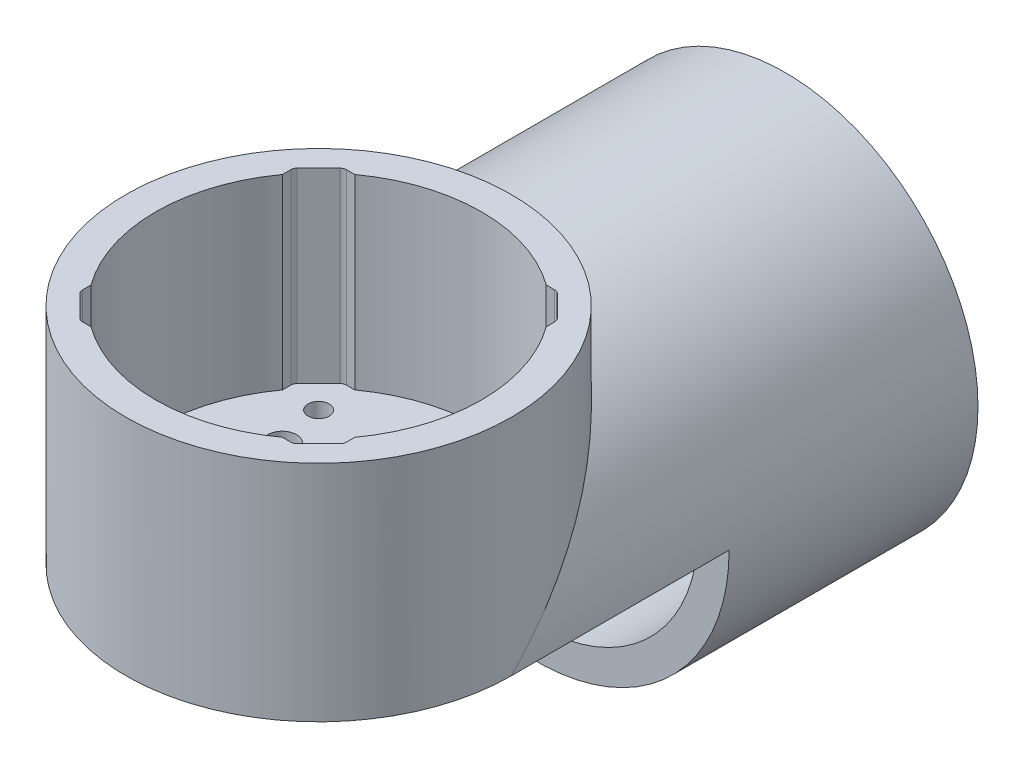
from build123d import *
from OCP.BRepAlgoAPI import BRepAlgoAPI_Cut
from OCP.TopTools import TopTools_ListOfShape
from build123d.topology import SkipClean

# Parameters (mm, degrees)
SKETCH3_R                = 31
SKETCH3_R_2              = 26
BOSS_EXTRUDE1_DEPTH      = 7.0104
SKETCH4_R                = 31
SKETCH4_R_2              = 26
BOSS_EXTRUDE2_DEPTH      = 10
SKETCH5_R                = 1.5
BOSS_EXTRUDE3_DEPTH      = 10
SKETCH7_R                = 31
SKETCH7_R_2              = 26
BOSS_EXTRUDE4_DEPTH      = 13
SKETCH9_R                = 31
SKETCH9_R_2              = 26.2
BOSS_EXTRUDE5_DEPTH      = 36
BOSS_EXTRUDE9_REACH      = 91.627
SKETCH35_R               = 26.2
BOSS_EXTRUDE10_DEPTH     = 6
SKETCH37_R               = 2.3
CUT_EXTRUDE1_DEPTH       = 6
SKETCH39_R               = 11.1
CUT_EXTRUDE2_DEPTH       = 2.1
SKETCH41_R               = 5
CUT_EXTRUDE3_DEPTH       = 4
SKETCH47_R               = 1.7
CUT_EXTRUDE7_DEPTH       = 115.339827959
CIRPATTERN1_START        = -1
CIRPATTERN1_OUTLINE_R    = 3.000000205
CIRPATTERN1_OUTLINE_R_2  = 1.7
CIRPATTERN1_DEPTH        = 2.5849999
BOSS_EXTRUDE11_DEPTH     = 10
CUT_EXTRUDE10_DEPTH      = 4.4
CUT_EXTRUDE10_DEPTH_BACK = 1
SKETCH48_W               = 5
SKETCH48_H               = 56
CUT_EXTRUDE12_DEPTH      = 128.254061851
CUT_EXTRUDE12_DEPTH_BACK = 30
SKETCH57_R               = 26
CUT_EXTRUDE15_DEPTH      = 8


with BuildPart() as part:
    # Sketch3 → Boss-Extrude1 (new body)
    with BuildSketch(Plane.XY.offset(-2.359079422)):
        with Locations(Location((0, 0, 0), (0, 0, 270))):
            Circle(SKETCH3_R)
        with Locations(Location((0, 0, 0), (0, 0, 270))):
            Circle(SKETCH3_R_2, mode=Mode.SUBTRACT)
    extrude(amount=BOSS_EXTRUDE1_DEPTH)

    # Sketch4 → Boss-Extrude2 (add)
    with BuildSketch(Plane.XY.offset(4.651320578)):
        Circle(SKETCH4_R)
        Circle(SKETCH4_R_2, mode=Mode.SUBTRACT)
    extrude(amount=BOSS_EXTRUDE2_DEPTH)

    # Sketch5 → Boss-Extrude3 (add)
    with BuildSketch(Plane.XY.offset(4.651320578)):
        with Locations((26, 0)):
            Circle(SKETCH5_R)
        with Locations((25.299166635, -5.996012639)):
            Circle(SKETCH5_R)
        with Locations((23.234448648, -11.668778685)):
            Circle(SKETCH5_R)
        with Locations((19.917155521, -16.712477852)):
            Circle(SKETCH5_R)
        with Locations((15.526123384, -20.855203012)):
            Circle(SKETCH5_R)
        with Locations((10.298073917, -23.873618779)):
            Circle(SKETCH5_R)
        with Locations((4.514852619, -25.605001578)):
            Circle(SKETCH5_R)
        with Locations((-1.511765552, -25.956012115)):
            Circle(SKETCH5_R)
        with Locations((-7.45688405, -24.90772732)):
            Circle(SKETCH5_R)
        with Locations((-13, -22.516660498)):
            Circle(SKETCH5_R)
        with Locations((-17.842282585, -18.911714681)):
            Circle(SKETCH5_R)
        with Locations((-21.722683097, -14.28723343)):
            Circle(SKETCH5_R)
        with Locations((-24.43200814, -8.892523726)):
            Circle(SKETCH5_R)
        with Locations((-25.824197301, -3.018415767)):
            Circle(SKETCH5_R)
        with Locations((-25.824197301, 3.018415767)):
            Circle(SKETCH5_R)
        with Locations((-24.43200814, 8.892523726)):
            Circle(SKETCH5_R)
        with Locations((-21.722683097, 14.28723343)):
            Circle(SKETCH5_R)
        with Locations((-17.842282585, 18.911714681)):
            Circle(SKETCH5_R)
        with Locations((-13, 22.516660498)):
            Circle(SKETCH5_R)
        with Locations((-7.45688405, 24.90772732)):
            Circle(SKETCH5_R)
        with Locations((-1.511765552, 25.956012115)):
            Circle(SKETCH5_R)
        with Locations((4.514852619, 25.605001578)):
            Circle(SKETCH5_R)
        with Locations((10.298073917, 23.873618779)):
            Circle(SKETCH5_R)
        with Locations((15.526123384, 20.855203012)):
            Circle(SKETCH5_R)
        with Locations((19.917155521, 16.712477852)):
            Circle(SKETCH5_R)
        with Locations((23.234448648, 11.668778685)):
            Circle(SKETCH5_R)
        with Locations((25.299166635, 5.996012639)):
            Circle(SKETCH5_R)
    extrude(amount=BOSS_EXTRUDE3_DEPTH)

    # Sketch7 → Boss-Extrude4 (add)
    with BuildSketch(Plane.XY.offset(14.651320578)):
        Circle(SKETCH7_R)
        Circle(SKETCH7_R_2, mode=Mode.SUBTRACT)
    extrude(amount=BOSS_EXTRUDE4_DEPTH)


with BuildPart() as body_2:
    # Sketch9 → Boss-Extrude5 (new body)
    with BuildSketch(Plane(origin=(0, 0, 0), x_dir=(1, 0, 0), z_dir=(0, 1, 0))):
        with Locations(Location((0, -72.651320578, 0), (0, 0, 270))):
            Circle(SKETCH9_R)
        with Locations(Location((0, -72.651320578, 0), (0, 0, 270))):
            Circle(SKETCH9_R_2, mode=Mode.SUBTRACT)
    extrude(amount=BOSS_EXTRUDE5_DEPTH)

    # Sketch34 → Boss-Extrude9 (add, up to next)
    with BuildSketch(Plane.XY.offset(27.651320578), mode=Mode.PRIVATE) as boss_extrude9_sk1:
        with BuildLine():
            Line((-31, 0), (-26, 0))
            ThreePointArc((-26, 0), (0, 26), (26, 0))
            Line((26, 0), (31, 0))
            ThreePointArc((31, 0), (0, 31), (-31, 0))
        make_face()
    boss_extrude9_tool1 = extrude(boss_extrude9_sk1.sketch, amount=BOSS_EXTRUDE9_REACH, mode=Mode.PRIVATE) - body_2.part

    add(part.part)  # Boss-Extrude9 merges part
    add(boss_extrude9_tool1.solids().sort_by_distance((28.5, 0.693181, 27.651321))[0])

    # Sketch35 → Boss-Extrude10 (add)
    with BuildSketch(Plane.XZ):
        with Locations(Location((0, 72.651320578, 0), (0, 0, 270))):
            Circle(SKETCH35_R)
    extrude(amount=-BOSS_EXTRUDE10_DEPTH)

    # Sketch37 → Cut-Extrude1 (cut)
    with BuildSketch(Plane(origin=(0, 6, 0), x_dir=(1, 0, 0), z_dir=(0, 1, 0))):
        with Locations(Location((0, -88.651320578, 0), (0, 0, 270))):
            Circle(SKETCH37_R)
        with Locations(Location((-13.856406461, -80.651320578, 0), (0, 0, 270))):
            Circle(SKETCH37_R)
        with Locations(Location((-13.856406461, -64.651320578, 0), (0, 0, 270))):
            Circle(SKETCH37_R)
        with Locations(Location((0, -56.651320578, 0), (0, 0, 270))):
            Circle(SKETCH37_R)
        with Locations(Location((13.856406461, -64.651320578, 0), (0, 0, 270))):
            Circle(SKETCH37_R)
        with Locations(Location((13.856406461, -80.651320578, 0), (0, 0, 270))):
            Circle(SKETCH37_R)
    extrude(amount=-CUT_EXTRUDE1_DEPTH, mode=Mode.SUBTRACT)

    # Sketch39 → Cut-Extrude2 (cut)
    with BuildSketch(Plane(origin=(0, 6, 0), x_dir=(1, 0, 0), z_dir=(0, 1, 0))):
        with Locations(Location((0, -72.651320578, 0), (0, 0, 270))):
            Circle(SKETCH39_R)
    extrude(amount=-CUT_EXTRUDE2_DEPTH, mode=Mode.SUBTRACT)

    # Sketch41 → Cut-Extrude3 (cut)
    with BuildSketch(Plane(origin=(0, 3.9, 0), x_dir=(1, 0, 0), z_dir=(0, 1, 0))):
        with Locations(Location((0, -72.651320578, 0), (0, 0, 270))):
            Circle(SKETCH41_R)
    extrude(amount=-CUT_EXTRUDE3_DEPTH, mode=Mode.SUBTRACT)

    # Sketch47 → Cut-Extrude7 (cut, through all)
    with BuildSketch(Plane(origin=(0, 6, 0), x_dir=(1, 0, 0), z_dir=(0, 1, 0))):
        with Locations(Location((-15.5, -88.15132, 0), (0, 0, 270))):
            Circle(SKETCH47_R)
        with Locations(Location((-15.499999422, -57.151320578, 0), (0, 0, 270))):
            Circle(SKETCH47_R)
        with Locations(Location((15.5, -57.151321156, 0), (0, 0, 270))):
            Circle(SKETCH47_R)
        with Locations(Location((15.499999422, -88.151320578, 0), (0, 0, 270))):
            Circle(SKETCH47_R)
    extrude(amount=-CUT_EXTRUDE7_DEPTH, mode=Mode.SUBTRACT)


with BuildPart() as cut_revolve1_tool:
    # Sketch43 → Cut-Revolve1 (revolve)
    with BuildSketch(Plane(origin=(-8.335079333, 0, 88.151320134), x_dir=(0.9999999999999999, 0, 1.8652727112514236e-08), z_dir=(-1.8652727112514233e-08, 0, 0.9999999999999998))):
        Polygon((20.835078549, 0), (22.135079128, 0), (22.135079128, 2.885), (20.835078549, 1.585), align=None)
    revolve(axis=Axis((15.499999422, 0, 88.151320578), (0, 1, 0)))


with BuildPart() as body_2_1:
    add(body_2.part)

    # Cut-Revolve1: cut by cut_revolve1_tool, with a tolerance
    cut_revolve1_stock = TopTools_ListOfShape()
    cut_revolve1_stock.Append(body_2_1.part.wrapped)
    cut_revolve1_tools = TopTools_ListOfShape()
    cut_revolve1_tools.Append(cut_revolve1_tool.part.wrapped)
    cut_revolve1_cut = BRepAlgoAPI_Cut()
    cut_revolve1_cut.SetArguments(cut_revolve1_stock)
    cut_revolve1_cut.SetTools(cut_revolve1_tools)
    cut_revolve1_cut.SetFuzzyValue(0.00001)
    cut_revolve1_cut.Build()
    add(Compound.cast(cut_revolve1_cut.Shape()).solids(), mode=Mode.REPLACE)


with BuildPart() as cirpattern1_tool:
    # CirPattern1: read off the stored shape, not the designer's step
    # CirPattern1 outline → CirPattern1 (new body)
    # profile 1 of 3: a face of its own
    with BuildSketch(Plane(origin=(0, 0, 0), x_dir=(1, 0, 0), z_dir=(0, 1, 0)).offset(CIRPATTERN1_START)):
        with Locations((15.5, -57.151321156)):
            Circle(CIRPATTERN1_OUTLINE_R)
        with Locations((15.5, -57.151321156)):
            Circle(CIRPATTERN1_OUTLINE_R_2, mode=Mode.SUBTRACT)
    # profile 2 of 3: a face of its own
    with BuildSketch(Plane(origin=(0, 0, 0), x_dir=(1, 0, 0), z_dir=(0, 1, 0)).offset(CIRPATTERN1_START)):
        with Locations((-15.499999422, -57.151320578)):
            Circle(CIRPATTERN1_OUTLINE_R)
        with Locations((-15.499999422, -57.151320578)):
            Circle(CIRPATTERN1_OUTLINE_R_2, mode=Mode.SUBTRACT)
    # profile 3 of 3: a face of its own
    with BuildSketch(Plane(origin=(0, 0, 0), x_dir=(1, 0, 0), z_dir=(0, 1, 0)).offset(CIRPATTERN1_START)):
        with Locations((-15.5, -88.15132)):
            Circle(CIRPATTERN1_OUTLINE_R)
        with Locations((-15.5, -88.15132)):
            Circle(CIRPATTERN1_OUTLINE_R_2, mode=Mode.SUBTRACT)
    extrude(amount=CIRPATTERN1_DEPTH)


with BuildPart() as body_2_2:
    add(body_2_1.part)

    # CirPattern1: cut by cirpattern1_tool, with a tolerance
    cirpattern1_stock = TopTools_ListOfShape()
    cirpattern1_stock.Append(body_2_2.part.wrapped)
    cirpattern1_tools = TopTools_ListOfShape()
    cirpattern1_tools.Append(cirpattern1_tool.part.wrapped)
    cirpattern1_cut = BRepAlgoAPI_Cut()
    cirpattern1_cut.SetArguments(cirpattern1_stock)
    cirpattern1_cut.SetTools(cirpattern1_tools)
    cirpattern1_cut.SetFuzzyValue(0.00001)
    cirpattern1_cut.Build()
    add(Compound.cast(cirpattern1_cut.Shape()).solids(), mode=Mode.REPLACE)


with BuildPart() as cirpattern1_2_tool:
    # CirPattern1 2: loft between two sections, ruled curve by curve
    cirpattern1_2_from = [
        Edge.make_three_point_arc((15.5, 2.885, 55.45132153), (17.199999627, 2.885, 57.151321156), (15.5, 2.885, 58.851320783)),
        Edge.make_three_point_arc((15.5, 2.885, 58.851320783), (13.800000373, 2.885, 57.151321156), (15.5, 2.885, 55.45132153)),
    ]
    cirpattern1_2_to = [
        Edge.make_three_point_arc((15.5, 1.585, 54.151320951), (18.500000205, 1.585, 57.151321156), (15.5, 1.585, 60.151321362)),
        Edge.make_three_point_arc((15.5, 1.585, 60.151321362), (12.499999795, 1.585, 57.151321156), (15.5, 1.585, 54.151320951)),
    ]
    cirpattern1_2 = Solid(Shell([*[Face.make_surface_from_curves(cirpattern1_2_from[k], cirpattern1_2_to[k]) for k in range(2)], Face(Wire(cirpattern1_2_from)), Face(Wire(cirpattern1_2_to))]))
    add(cirpattern1_2)


with BuildPart() as body_2_3:
    add(body_2_2.part)

    # CirPattern1 2: cut by cirpattern1_2_tool, with a tolerance
    cirpattern1_2_stock = TopTools_ListOfShape()
    cirpattern1_2_stock.Append(body_2_3.part.wrapped)
    cirpattern1_2_tools = TopTools_ListOfShape()
    cirpattern1_2_tools.Append(cirpattern1_2_tool.part.wrapped)
    cirpattern1_2_cut = BRepAlgoAPI_Cut()
    cirpattern1_2_cut.SetArguments(cirpattern1_2_stock)
    cirpattern1_2_cut.SetTools(cirpattern1_2_tools)
    cirpattern1_2_cut.SetFuzzyValue(0.00001)
    cirpattern1_2_cut.Build()
    add(Compound.cast(cirpattern1_2_cut.Shape()).solids(), mode=Mode.REPLACE)


with BuildPart() as cirpattern1_3_tool:
    # CirPattern1 3: loft between two sections, ruled curve by curve
    cirpattern1_3_from = [
        Edge.make_three_point_arc((-17.199999049, 2.885, 57.151320578), (-15.499999422, 2.885, 55.451320951), (-13.799999795, 2.885, 57.151320578)),
        Edge.make_three_point_arc((-13.799999795, 2.885, 57.151320578), (-15.499999422, 2.885, 58.851320205), (-17.199999049, 2.885, 57.151320578)),
    ]
    cirpattern1_3_to = [
        Edge.make_three_point_arc((-18.499999627, 1.585, 57.151320578), (-15.499999422, 1.585, 54.151320373), (-12.499999217, 1.585, 57.151320578)),
        Edge.make_three_point_arc((-12.499999217, 1.585, 57.151320578), (-15.499999422, 1.585, 60.151320783), (-18.499999627, 1.585, 57.151320578)),
    ]
    cirpattern1_3 = Solid(Shell([*[Face.make_surface_from_curves(cirpattern1_3_from[k], cirpattern1_3_to[k]) for k in range(2)], Face(Wire(cirpattern1_3_from)), Face(Wire(cirpattern1_3_to))]))
    add(cirpattern1_3)


with BuildPart() as body_2_4:
    add(body_2_3.part)

    # CirPattern1 3: cut by cirpattern1_3_tool, with a tolerance
    cirpattern1_3_stock = TopTools_ListOfShape()
    cirpattern1_3_stock.Append(body_2_4.part.wrapped)
    cirpattern1_3_tools = TopTools_ListOfShape()
    cirpattern1_3_tools.Append(cirpattern1_3_tool.part.wrapped)
    cirpattern1_3_cut = BRepAlgoAPI_Cut()
    cirpattern1_3_cut.SetArguments(cirpattern1_3_stock)
    cirpattern1_3_cut.SetTools(cirpattern1_3_tools)
    cirpattern1_3_cut.SetFuzzyValue(0.00001)
    cirpattern1_3_cut.Build()
    add(Compound.cast(cirpattern1_3_cut.Shape()).solids(), mode=Mode.REPLACE)


with BuildPart() as cirpattern1_4_tool:
    # CirPattern1 4: loft between two sections, ruled curve by curve
    cirpattern1_4_from = [
        Edge.make_three_point_arc((-15.5, 2.885, 89.851319627), (-17.199999627, 2.885, 88.15132), (-15.5, 2.885, 86.451320373)),
        Edge.make_three_point_arc((-15.5, 2.885, 86.451320373), (-13.800000373, 2.885, 88.15132), (-15.5, 2.885, 89.851319627)),
    ]
    cirpattern1_4_to = [
        Edge.make_three_point_arc((-15.5, 1.585, 91.151320205), (-18.500000205, 1.585, 88.15132), (-15.5, 1.585, 85.151319795)),
        Edge.make_three_point_arc((-15.5, 1.585, 85.151319795), (-12.499999795, 1.585, 88.15132), (-15.5, 1.585, 91.151320205)),
    ]
    cirpattern1_4 = Solid(Shell([*[Face.make_surface_from_curves(cirpattern1_4_from[k], cirpattern1_4_to[k]) for k in range(2)], Face(Wire(cirpattern1_4_from)), Face(Wire(cirpattern1_4_to))]))
    add(cirpattern1_4)


with BuildPart() as body_2_5:
    add(body_2_4.part)

    # CirPattern1 4: cut by cirpattern1_4_tool, with a tolerance
    cirpattern1_4_stock = TopTools_ListOfShape()
    cirpattern1_4_stock.Append(body_2_5.part.wrapped)
    cirpattern1_4_tools = TopTools_ListOfShape()
    cirpattern1_4_tools.Append(cirpattern1_4_tool.part.wrapped)
    cirpattern1_4_cut = BRepAlgoAPI_Cut()
    cirpattern1_4_cut.SetArguments(cirpattern1_4_stock)
    cirpattern1_4_cut.SetTools(cirpattern1_4_tools)
    cirpattern1_4_cut.SetFuzzyValue(0.00001)
    cirpattern1_4_cut.Build()
    add(Compound.cast(cirpattern1_4_cut.Shape()).solids(), mode=Mode.REPLACE)

    # Sketch56 → Boss-Extrude11 (add)
    with SkipClean():  # the faces are left unmerged after this step: merging them gives an invalid solid
        with BuildSketch(Plane.XY.offset(27.651320578)):
            with BuildLine():
                Line((-31, 0), (-26, 0))
                ThreePointArc((-26, 0), (0, -26), (26, 0))
                Line((26, 0), (31, 0))
                ThreePointArc((31, 0), (0, -31), (-31, 0))
            make_face()
        extrude(amount=BOSS_EXTRUDE11_DEPTH)

    # Sketch48 → Cut-Extrude10 (cut, two sides: drawn at the far end of the back side and taken through both)
    with SkipClean():  # the faces are left unmerged after this step: merging them gives an invalid solid
        with BuildSketch(Plane(origin=(0, 0, 37.640920578), x_dir=(-1, 0, 0), z_dir=(0, 0, -1)).offset(-CUT_EXTRUDE10_DEPTH_BACK)):
            Rectangle(SKETCH48_W, SKETCH48_H)
        extrude(amount=CUT_EXTRUDE10_DEPTH + CUT_EXTRUDE10_DEPTH_BACK, mode=Mode.SUBTRACT)

    # Sketch51 → Cut-Extrude12 (cut, two sides: drawn at the far end of the back side and taken through both)
    with SkipClean():  # the faces are left unmerged after this step: merging them gives an invalid solid
        with BuildSketch(Plane(origin=(0, 36, 0), x_dir=(1, 0, 0), z_dir=(0, 1, 0)).offset(-CUT_EXTRUDE12_DEPTH_BACK)):
            with BuildLine():
                Line((-14.238968268, -93.857120578), (-16.748327145, -93.857120578))
                ThreePointArc((-16.748327145, -93.857120578), (-17.134760875, -93.78025413), (-17.462363572, -93.561357006))
                Line((-17.462363572, -93.561357006), (-20.910036428, -90.113684151))
                ThreePointArc((-20.910036428, -90.113684151), (-21.128933552, -89.786081453), (-21.2058, -89.399647723))
                Line((-21.2058, -89.399647723), (-21.2058, -86.890288846))
                Line((-21.2058, -86.890288846), (-21.2058, -58.41235231))
                Line((-21.2058, -58.41235231), (-21.2058, -55.902993434))
                ThreePointArc((-21.2058, -55.902993434), (-21.128933552, -55.516559704), (-20.910036428, -55.188957006))
                Line((-20.910036428, -55.188957006), (-17.462363572, -51.741284151))
                ThreePointArc((-17.462363572, -51.741284151), (-17.134760875, -51.522387026), (-16.748327145, -51.445520578))
                Line((-16.748327145, -51.445520578), (-14.238968268, -51.445520578))
                Line((-14.238968268, -51.445520578), (14.238968268, -51.445520578))
                Line((14.238968268, -51.445520578), (16.748327145, -51.445520578))
                ThreePointArc((16.748327145, -51.445520578), (17.134760875, -51.522387026), (17.462363572, -51.741284151))
                Line((17.462363572, -51.741284151), (20.910036428, -55.188957006))
                ThreePointArc((20.910036428, -55.188957006), (21.128933552, -55.516559704), (21.2058, -55.902993434))
                Line((21.2058, -55.902993434), (21.2058, -58.41235231))
                Line((21.2058, -58.41235231), (21.2058, -86.890288846))
                Line((21.2058, -86.890288846), (21.2058, -89.399647723))
                ThreePointArc((21.2058, -89.399647723), (21.128933552, -89.786081453), (20.910036428, -90.113684151))
                Line((20.910036428, -90.113684151), (17.462363572, -93.561357006))
                ThreePointArc((17.462363572, -93.561357006), (17.134760875, -93.78025413), (16.748327145, -93.857120578))
                Line((16.748327145, -93.857120578), (14.238968268, -93.857120578))
                Line((14.238968268, -93.857120578), (-14.238968268, -93.857120578))
            make_face()
        extrude(amount=CUT_EXTRUDE12_DEPTH + CUT_EXTRUDE12_DEPTH_BACK, mode=Mode.SUBTRACT)

    # Sketch57 → Cut-Extrude15 (cut)
    with SkipClean():  # the faces are left unmerged after this step: merging them gives an invalid solid
        with BuildSketch(Plane.XY.offset(37.651320578)):
            Circle(SKETCH57_R)
        extrude(amount=CUT_EXTRUDE15_DEPTH, mode=Mode.SUBTRACT)


solid = body_2_5.part
